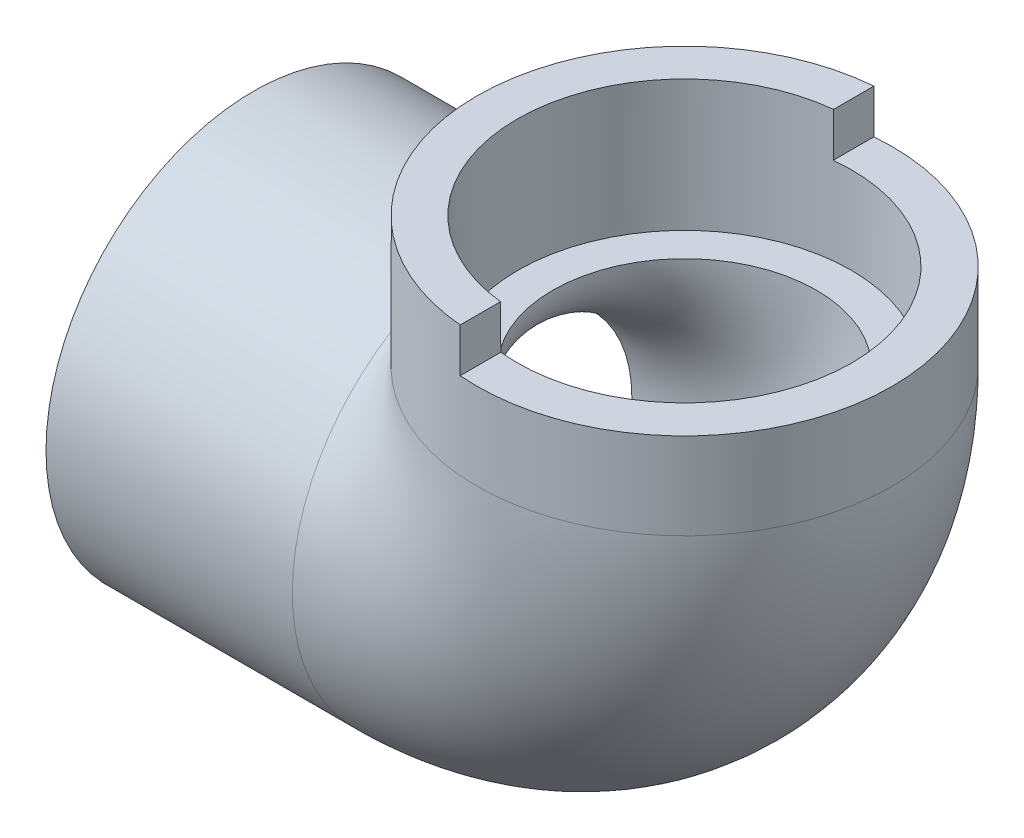
from build123d import *

# Parameters (mm, degrees)
SKETCH3_R               = 29.972
SKETCH3_R_2             = 19.05
SKETCH6_W               = 49.478831
SKETCH6_H               = 30.48
CUT_EXTRUDE2_DEPTH      = 93.970246
CUT_EXTRUDE3_DEPTH      = 93.970246
CUT_EXTRUDE3_DEPTH_BACK = 2.54
SKETCH7_W               = 63.5
SKETCH7_H               = 6.35
SKETCH8_R               = 43.612232
CUT_EXTRUDE4_DEPTH      = 103.320343


with BuildPart() as part:
    # Sketch1 → Revolve1 (revolve)
    with BuildSketch(Plane.XY):
        Polygon((-62.23, -29.972), (-26.67, -29.972), (-26.67, -24.0538), (-62.23, -24.2824), align=None)
    revolve(axis=Axis((-62.23, 0, 0), (1, 0, 0)))


with BuildPart() as body_2:
    # Sketch2 → Revolve2 (revolve)
    with BuildSketch(Plane.XY):
        Polygon((24.2824, 62.23), (24.0538, 26.67), (29.972, 26.67), (29.972, 62.23), align=None)
    revolve(axis=Axis((0, 0, 0), (0, 1, 0)))


with BuildPart() as sweep1_tool:
    # Sweep1: sweep along a path in Sketch4
    with BuildLine(Plane.XY) as sweep1_path:
        ThreePointArc((-26.67, 0), (-7.811462, 7.811462), (0, 26.67))
    # Sketch3 → Sweep1 (sweep)
    with BuildSketch(Plane(origin=(-26.67, 0, 0), x_dir=(0, 0, -1), z_dir=(1, 0, 0))):
        Circle(SKETCH3_R)
        Circle(SKETCH3_R_2, mode=Mode.SUBTRACT)
    sweep(path=sweep1_path.line)


with BuildPart() as part_1:
    add(part.part)


with BuildPart() as part_2:
    # Sweep1: joined with sweep1_tool
    add(part_1.part.fuse(sweep1_tool.part, body_2.part, tol=0.00001))

    # Sketch6 → Cut-Extrude2 (cut, through all)
    with BuildSketch(Plane.XY):
        with Locations((-54.863748, 0)):
            Rectangle(SKETCH6_W, SKETCH6_H)
    extrude(amount=-CUT_EXTRUDE2_DEPTH, mode=Mode.SUBTRACT)

    # Sketch7 → Cut-Extrude3 (cut, two sides: drawn at the far end of the back side and taken through both)
    with BuildSketch(Plane(origin=(0, 0, 0), x_dir=(0, 0, -1), z_dir=(1, 0, 0)).offset(-CUT_EXTRUDE3_DEPTH_BACK)):
        with Locations((0, 42.3418)):
            Rectangle(SKETCH7_W, SKETCH7_H)
    extrude(amount=CUT_EXTRUDE3_DEPTH + CUT_EXTRUDE3_DEPTH_BACK, mode=Mode.SUBTRACT)

    # Sketch8 → Cut-Extrude4 (cut, through all)
    with BuildSketch(Plane.XZ.offset(-45.5168)):
        Circle(SKETCH8_R)
    extrude(amount=-CUT_EXTRUDE4_DEPTH, mode=Mode.SUBTRACT)


solid = part_2.part
